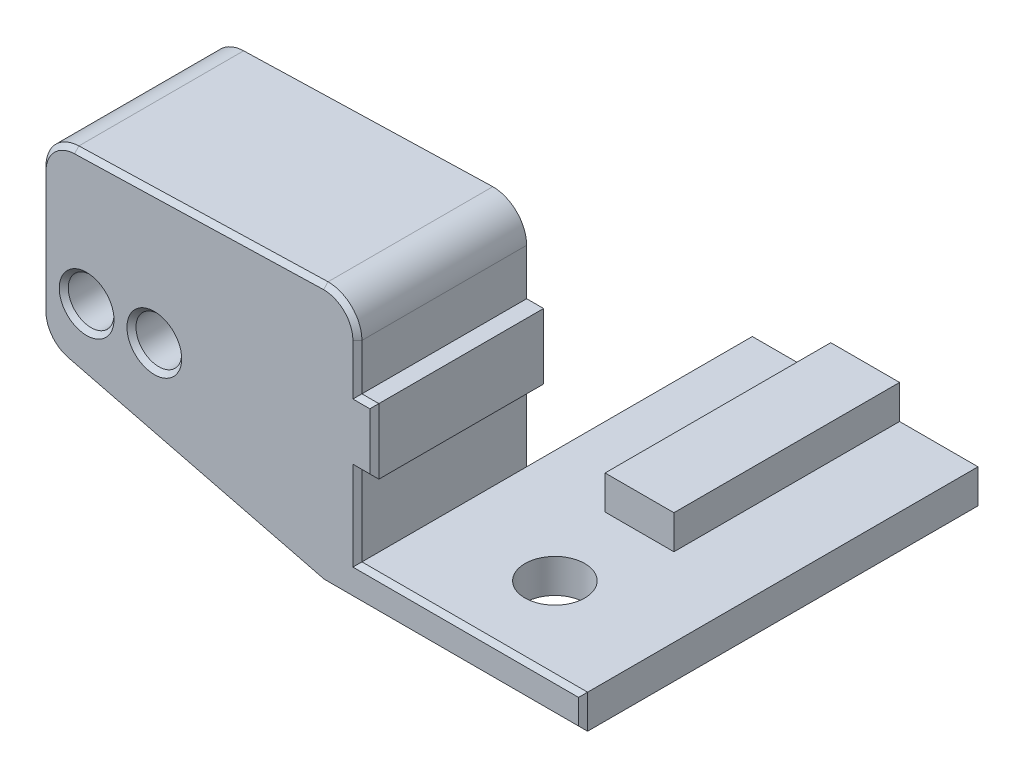
from build123d import *

# Parameters (mm, degrees)
SKETCH1_R           = 3.025
SKETCH1_R_2         = 2.025
BOSS_EXTRUDE1_DEPTH = 15
BOSS_EXTRUDE2_START = 5.6
SKETCH1_2_R         = 3.025
BOSS_EXTRUDE2_DEPTH = 9.4
BOSS_EXTRUDE3_DEPTH = 20
SKETCH2_R           = 2.65
CUT_EXTRUDE1_DEPTH  = 70
FILLET1_R           = 3
CHAMFER1_SIZE       = 0.4


# Some blends are built 0.0001 mm under size
with BuildPart() as part:
    # Sketch1 → Boss-Extrude1 (new body)
    with BuildSketch(Plane.XY):
        Polygon((66.489922843, -72.31585339), (69.489922843, -72.31585339), (69.489922843, -79.41585339), (70.989922843, -79.41585339), (70.989922843, -85.21585339), (69.489922843, -85.21585339), (69.489922843, -92.31585339), (76.589922843, -92.31585339), (82.389922843, -92.31585339), (89.489922843, -92.31585339), (89.489922843, -95.31585339), (66.489922843, -95.31585339), (41.489922843, -89.06585339), (41.489922843, -73.010297834), align=None)
        with Locations((48.489922843, -77.31585339)):
            Circle(SKETCH1_R, mode=Mode.SUBTRACT)
        with Locations((45.489922843, -84.31585339)):
            Circle(SKETCH1_R_2, mode=Mode.SUBTRACT)
        with Locations((51.489922843, -84.31585339)):
            Circle(SKETCH1_R_2, mode=Mode.SUBTRACT)
    extrude(amount=BOSS_EXTRUDE1_DEPTH)

    # Sketch1<2> → Boss-Extrude2 (add)
    with BuildSketch(Plane.XY.offset(BOSS_EXTRUDE2_START)):
        with Locations((48.489922843, -77.31585339)):
            Circle(SKETCH1_2_R)
    extrude(amount=BOSS_EXTRUDE2_DEPTH)

    # Sketch3 → Boss-Extrude3 (add)
    with BuildSketch(Plane(origin=(0, 0, 0), x_dir=(-1, 0, 0), z_dir=(0, 0, -1))):
        Polygon((-76.439922843, -92.31585339), (-69.489922843, -92.31585339), (-69.489922843, -95.31585339), (-89.489922843, -95.31585339), (-89.489922843, -92.31585339), (-82.539922843, -92.31585339), (-82.539922843, -89.31585339), (-76.439922843, -89.31585339), align=None)
    extrude(amount=BOSS_EXTRUDE3_DEPTH)

    # Sketch2 → Cut-Extrude1 (cut)
    with BuildSketch(Plane.XZ.offset(95.31585339)):
        with Locations(Location((79.489922843, 7.5, 0), (0, 0, 270))):
            Circle(SKETCH2_R)
    extrude(amount=-CUT_EXTRUDE1_DEPTH, mode=Mode.SUBTRACT)

    # Fillet1
    fillet1_edges = [part.edges().sort_by_distance(p)[0] for p in [
        (69.489922843, -72.31585339, 7.5),
        (41.489922843, -73.010297834, 7.5),
        (41.489922843, -89.06585339, 7.5),
    ]]
    fillet(fillet1_edges, radius=FILLET1_R - 0.0001)  # a hair under: the kernel refuses the full size

    # Chamfer1
    # the kernel refuses this chamfer: 0.4 mm, written as the material it takes off along each edge
    with BuildSketch(Plane(origin=(90.518596038, -95.31585339, 15), x_dir=(0, 0.9996219169112966, 0.02749587661058671), z_dir=(-1, 0, 0))) as chamfer1_piece_1:
        Polygon((CHAMFER1_SIZE * 0.999621916911, CHAMFER1_SIZE * 0.0274958766106), (-CHAMFER1_SIZE * 0.0274958766106, CHAMFER1_SIZE * 0.999621916911), (0, 0), align=None)
    extrude(amount=25.05734639, mode=Mode.SUBTRACT)
    with BuildSketch(Plane(origin=(89.489922843, -91.287180195, 15), x_dir=(-0.9996219169112966, 0, 0.02749587661058671), z_dir=(0, -1, 0))) as chamfer1_piece_2:
        Polygon((CHAMFER1_SIZE * 0.999621916911, CHAMFER1_SIZE * 0.0274958766106), (-CHAMFER1_SIZE * 0.0274958766106, CHAMFER1_SIZE * 0.999621916911), (0, 0), align=None)
    extrude(amount=5.05734639, mode=Mode.SUBTRACT)
    with BuildSketch(Plane(origin=(69.489922843, -92.31585339, 15), x_dir=(0, -0.9996219169112966, 0.02749587661058671), z_dir=(1, 0, 0))) as chamfer1_piece_3:
        Polygon((CHAMFER1_SIZE * 0.999621916911, CHAMFER1_SIZE * 0.0274958766106), (-CHAMFER1_SIZE * 0.0274958766106, CHAMFER1_SIZE * 0.999621916911), (0, 0), align=None)
    extrude(amount=21.028673195, mode=Mode.SUBTRACT)
    with BuildSketch(Plane(origin=(69.489922843, -85.21585339, 15), x_dir=(-0.9996219169112966, -2.1408261351483406e-13, 0.02749587661058671), z_dir=(0, -1, 0))) as chamfer1_piece_4:
        Polygon((CHAMFER1_SIZE * 0.999621916911, CHAMFER1_SIZE * 0.0274958766106), (-CHAMFER1_SIZE * 0.0274958766106, CHAMFER1_SIZE * 0.999621916911), (0, 0), align=None)
    extrude(amount=7.1, mode=Mode.SUBTRACT)
    with BuildSketch(Plane(origin=(45.489922843, -84.31585339, 15), x_dir=(1, 0, 0), z_dir=(0, -1, 0))) as chamfer1_piece_5:
        Polygon((2.025 + CHAMFER1_SIZE, 0), (2.025, -CHAMFER1_SIZE), (2.025, 0), align=None)
    revolve(axis=Axis((45.489922843, -84.31585339, 15), (0, 0, 1)), mode=Mode.SUBTRACT)
    with BuildSketch(Plane(origin=(72.018596038, -85.21585339, 15), x_dir=(0, 0.9996219169112966, 0.02749587661058671), z_dir=(-1, 0, 0)), Plane(origin=(69.489922843, -79.41585339, 15), x_dir=(0, -0.9996219169112966, 0.02749587661058671), z_dir=(1, 0, 0))) as chamfer1_piece_6:
        Polygon((CHAMFER1_SIZE * 0.999621916911, CHAMFER1_SIZE * 0.0274958766106), (-CHAMFER1_SIZE * 0.0274958766106, CHAMFER1_SIZE * 0.999621916911), (0, 0), align=None)
    extrude(amount=2.528673195, mode=Mode.SUBTRACT)
    with BuildSketch(Plane(origin=(51.489922843, -84.31585339, 15), x_dir=(1, 0, 0), z_dir=(0, -1, 0))) as chamfer1_piece_7:
        Polygon((2.025 + CHAMFER1_SIZE, 0), (2.025, -CHAMFER1_SIZE), (2.025, 0), align=None)
    revolve(axis=Axis((51.489922843, -84.31585339, 15), (0, 0, 1)), mode=Mode.SUBTRACT)
    with BuildSketch(Plane(origin=(70.989922843, -78.387180195, 15), x_dir=(-0.9996219169112966, -2.6206664757850423e-13, 0.02749587661058671), z_dir=(0, -1, 0))) as chamfer1_piece_8:
        Polygon((CHAMFER1_SIZE * 0.999621916911, CHAMFER1_SIZE * 0.0274958766106), (-CHAMFER1_SIZE * 0.0274958766106, CHAMFER1_SIZE * 0.999621916911), (0, 0), align=None)
    extrude(amount=7.85734639, mode=Mode.SUBTRACT)
    with BuildSketch(Plane(origin=(44.406524418, -72.929281124, 15), x_dir=(-0.0007634798546782339, 0.027485274768416574, -0.9996219169112971), z_dir=(0.9996144206527183, 0.027767067240353136, 0))) as chamfer1_piece_9:
        Polygon((CHAMFER1_SIZE * 0.999621916911, -CHAMFER1_SIZE * 0.0274958766106), (-CHAMFER1_SIZE * 0.0274958766106, -CHAMFER1_SIZE * 0.999621916911), (0, 0), align=None)
    extrude(amount=23.120589807, mode=Mode.SUBTRACT)
    with BuildSketch(Plane(origin=(69.489922843, -75.31575339, 15), x_dir=(-0.9996219169112966, 2.140826135148345e-13, 0.02749587661058671), z_dir=(0, -1, 0))) as chamfer1_piece_10:
        Polygon((CHAMFER1_SIZE * 0.999621916911, CHAMFER1_SIZE * 0.0274958766106), (-CHAMFER1_SIZE * 0.0274958766106, CHAMFER1_SIZE * 0.999621916911), (0, 0), align=None)
    extrude(amount=4.1001, mode=Mode.SUBTRACT)
    with BuildSketch(Plane(origin=(41.489922843, -86.723602248, 15), x_dir=(0.9996219169112966, 0, 0.027495876610587656), z_dir=(0, 1, 0))) as chamfer1_piece_11:
        Polygon((CHAMFER1_SIZE * 0.999621916911, CHAMFER1_SIZE * 0.0274958766106), (-CHAMFER1_SIZE * 0.0274958766106, CHAMFER1_SIZE * 0.999621916911), (0, 0), align=None)
    extrude(amount=10.795577824, mode=Mode.SUBTRACT)
    with BuildSketch(Plane(origin=(67.487882428, -95.565343286, 15), x_dir=(0.24244392641809726, 0.9697757056723949, 0.027495876610587038), z_dir=(-0.9701425001453322, 0.2425356250363316, 0))) as chamfer1_piece_12:
        Polygon((CHAMFER1_SIZE * 0.999621916911, CHAMFER1_SIZE * 0.0274958766106), (-CHAMFER1_SIZE * 0.0274958766106, CHAMFER1_SIZE * 0.999621916911), (0, 0), align=None)
    extrude(amount=24.455832214, mode=Mode.SUBTRACT)
    with BuildSketch(Plane(origin=(44.489822843, -86.723602248, 15), x_dir=(-1, 0, 0), z_dir=(0, 1, 0))) as chamfer1_piece_13:
        Polygon((2.9999 - CHAMFER1_SIZE, 0), (2.9999, -CHAMFER1_SIZE), (2.9999, 0), align=None)
    revolve(axis=Axis((44.489822843, -86.723602248, 15), (0, 0, 1)), revolution_arc=75.963756532, mode=Mode.SUBTRACT)
    with BuildSketch(Plane(origin=(44.489822843, -75.928024424, 15), x_dir=(-0.02776706724035276, 0.9996144206527183, 0), z_dir=(0.9996144206527183, 0.02776706724035276, 0))) as chamfer1_piece_14:
        Polygon((2.9999 - CHAMFER1_SIZE, 0), (2.9999, -CHAMFER1_SIZE), (2.9999, 0), align=None)
    revolve(axis=Axis((44.489822843, -75.928024424, 15), (0, 0, 1)), revolution_arc=88.408859729, mode=Mode.SUBTRACT)
    with BuildSketch(Plane(origin=(66.490022843, -75.31575339, 15), x_dir=(0, 1, 0), z_dir=(-1, 0, 0))) as chamfer1_piece_15:
        Polygon((2.9999, CHAMFER1_SIZE), (2.9999 - CHAMFER1_SIZE, 0), (2.9999, 0), align=None)
    revolve(axis=Axis((66.490022843, -75.31575339, 15), (0, 0, -1)), revolution_arc=90, mode=Mode.SUBTRACT)
    with BuildSketch(Plane(origin=(65.461249648, -72.31585339, 15), x_dir=(0, 0.027495876610595927, -0.9996219169112964), z_dir=(1, 0, 0))) as chamfer1_piece_16:
        Polygon((CHAMFER1_SIZE * 0.999621916911, -CHAMFER1_SIZE * 0.0274958766106), (-CHAMFER1_SIZE * 0.0274958766106, -CHAMFER1_SIZE * 0.999621916911), (0, 0), align=None)
    extrude(amount=1.028773195, mode=Mode.SUBTRACT)
    with BuildSketch(Plane(origin=(69.489922843, -85.21585339, 15), x_dir=(-0.9996219169112966, -2.1408261351483406e-13, 0.02749587661058671), z_dir=(0, -1, 0))) as chamfer1_piece_17a_section:
        Polygon((CHAMFER1_SIZE * 0.999621916911, CHAMFER1_SIZE * 0.0274958766106), (-CHAMFER1_SIZE * 0.0274958766106, CHAMFER1_SIZE * 0.999621916911), (0, 0), align=None)
    chamfer1_piece_17a = extrude(amount=8.128673195, mode=Mode.PRIVATE)
    chamfer1_piece_17a = split(chamfer1_piece_17a, bisect_by=Plane(origin=(69.358005392, -92.31585339, 14.868082549), z_dir=(0, -1, 0)), keep=Keep.TOP, mode=Mode.PRIVATE)
    with BuildSketch(Plane(origin=(68.461249648, -92.31585339, 15), x_dir=(0, -0.9996219169112966, 0.02749587661058671), z_dir=(1, 0, 0))) as chamfer1_piece_17b_section:
        Polygon((CHAMFER1_SIZE * 0.999621916911, CHAMFER1_SIZE * 0.0274958766106), (-CHAMFER1_SIZE * 0.0274958766106, CHAMFER1_SIZE * 0.999621916911), (0, 0), align=None)
    chamfer1_piece_17b = extrude(amount=22.05734639, mode=Mode.PRIVATE)
    chamfer1_piece_17b = split(chamfer1_piece_17b, bisect_by=Plane(origin=(69.489922843, -92.44777084, 14.868082549), z_dir=(-1, 0, 0)), keep=Keep.TOP, mode=Mode.PRIVATE)
    chamfer1_piece_17 = chamfer1_piece_17a & chamfer1_piece_17b
    add(chamfer1_piece_17, mode=Mode.SUBTRACT)
    with BuildSketch(Plane(origin=(72.018596038, -85.21585339, 15), x_dir=(0, 0.9996219169112966, 0.02749587661058671), z_dir=(-1, 0, 0))) as chamfer1_piece_18a_section:
        Polygon((CHAMFER1_SIZE * 0.999621916911, CHAMFER1_SIZE * 0.0274958766106), (-CHAMFER1_SIZE * 0.0274958766106, CHAMFER1_SIZE * 0.999621916911), (0, 0), align=None)
    chamfer1_piece_18a = extrude(amount=3.55734639, mode=Mode.PRIVATE)
    chamfer1_piece_18a = split(chamfer1_piece_18a, bisect_by=Plane(origin=(69.489922843, -85.083935939, 14.868082549), z_dir=(-1, 0, 0)), keep=Keep.TOP, mode=Mode.PRIVATE)
    with BuildSketch(Plane(origin=(69.489922843, -84.187180195, 15), x_dir=(-0.9996219169112966, -2.1408261351483406e-13, 0.02749587661058671), z_dir=(0, -1, 0))) as chamfer1_piece_18b_section:
        Polygon((CHAMFER1_SIZE * 0.999621916911, CHAMFER1_SIZE * 0.0274958766106), (-CHAMFER1_SIZE * 0.0274958766106, CHAMFER1_SIZE * 0.999621916911), (0, 0), align=None)
    chamfer1_piece_18b = extrude(amount=8.128673195, mode=Mode.PRIVATE)
    chamfer1_piece_18b = split(chamfer1_piece_18b, bisect_by=Plane(origin=(69.358005392, -85.21585339, 14.868082549), z_dir=(0, 1, 0)), keep=Keep.TOP, mode=Mode.PRIVATE)
    chamfer1_piece_18 = chamfer1_piece_18a & chamfer1_piece_18b
    add(chamfer1_piece_18, mode=Mode.SUBTRACT)
    with BuildSketch(Plane(origin=(69.489922843, -75.31575339, 15), x_dir=(-0.9996219169112966, 2.140826135148345e-13, 0.02749587661058671), z_dir=(0, -1, 0))) as chamfer1_piece_19a_section:
        Polygon((CHAMFER1_SIZE * 0.999621916911, CHAMFER1_SIZE * 0.0274958766106), (-CHAMFER1_SIZE * 0.0274958766106, CHAMFER1_SIZE * 0.999621916911), (0, 0), align=None)
    chamfer1_piece_19a = extrude(amount=5.128773195, mode=Mode.PRIVATE)
    chamfer1_piece_19a = split(chamfer1_piece_19a, bisect_by=Plane(origin=(69.358005392, -79.41585339, 14.868082549), z_dir=(0, -1, 0)), keep=Keep.TOP, mode=Mode.PRIVATE)
    with BuildSketch(Plane(origin=(68.461249648, -79.41585339, 15), x_dir=(0, -0.9996219169112966, 0.02749587661058671), z_dir=(1, 0, 0))) as chamfer1_piece_19b_section:
        Polygon((CHAMFER1_SIZE * 0.999621916911, CHAMFER1_SIZE * 0.0274958766106), (-CHAMFER1_SIZE * 0.0274958766106, CHAMFER1_SIZE * 0.999621916911), (0, 0), align=None)
    chamfer1_piece_19b = extrude(amount=3.55734639, mode=Mode.PRIVATE)
    chamfer1_piece_19b = split(chamfer1_piece_19b, bisect_by=Plane(origin=(69.489922843, -79.54777084, 14.868082549), z_dir=(-1, 0, 0)), keep=Keep.TOP, mode=Mode.PRIVATE)
    chamfer1_piece_19 = chamfer1_piece_19a & chamfer1_piece_19b
    add(chamfer1_piece_19, mode=Mode.SUBTRACT)


solid = part.part
